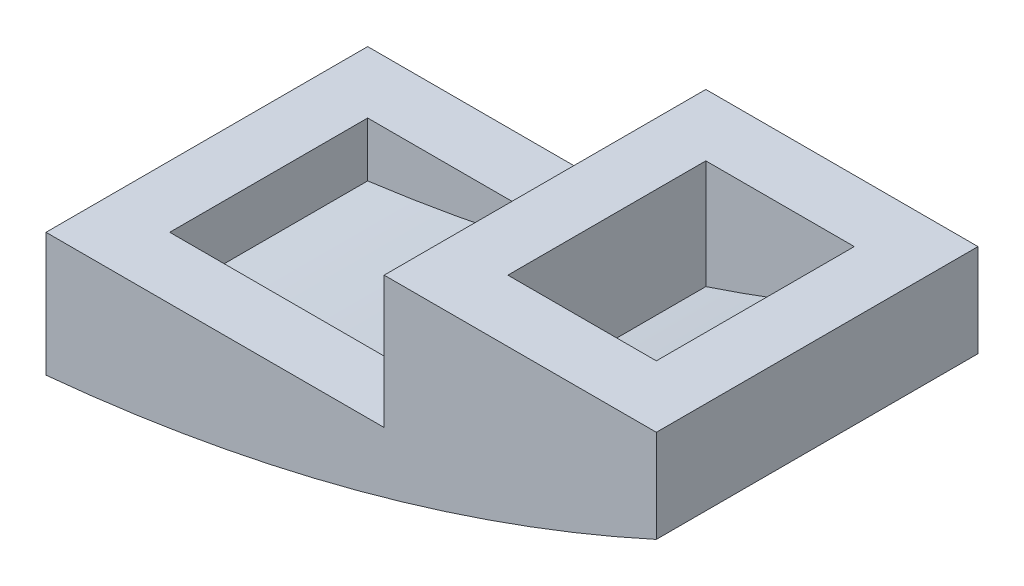
from build123d import *

# Parameters (mm, degrees)
BOSS_EXTRUDE1_DEPTH = 7.8
SHELL1_START        = -6.3
SHELL1_DEPTH        = 4.8


# Read off the part's stored shape, not the designer's step: Shell1
with BuildPart() as part:
    # Sketch1 → Boss-Extrude1 (new body)
    with BuildSketch(Plane.XY):
        with BuildLine():
            Line((19.130275644, -41.976412541), (19.130275644, -39.726412541))
            Line((19.130275644, -39.726412541), (12.530275644, -39.726412541))
            Line((12.530275644, -39.726412541), (12.530275644, -42.926412541))
            Line((12.530275644, -42.926412541), (4.330275644, -42.926412541))
            Line((4.330275644, -42.926412541), (4.330275644, -45.926412541))
            ThreePointArc((4.330275644, -45.926412541), (11.895376904, -44.570019793), (19.130275644, -41.976412541))
        make_face()
    extrude(amount=-BOSS_EXTRUDE1_DEPTH)

    # Shell1 outline → Shell1 (cut)
    with BuildSketch(Plane.XY.offset(SHELL1_START)):
        with BuildLine():
            Line((14.030275644, -39.726412541), (14.030275644, -42.367413234))
            ThreePointArc((14.030275644, -42.367413234), (15.845028157, -41.722672751), (17.630275644, -41.000240481))
            Line((17.630275644, -41.000240481), (17.630275644, -39.726412541))
            Line((17.630275644, -39.726412541), (14.030275644, -39.726412541))
        make_face()
        with BuildLine():
            Line((5.830275644, -42.926412541), (5.830275644, -44.247646544))
            ThreePointArc((5.830275644, -44.247646544), (9.046039137, -43.703724266), (12.213494388, -42.926412541))
            Line((12.213494388, -42.926412541), (5.830275644, -42.926412541))
        make_face()
    extrude(amount=SHELL1_DEPTH, mode=Mode.SUBTRACT)


solid = part.part
